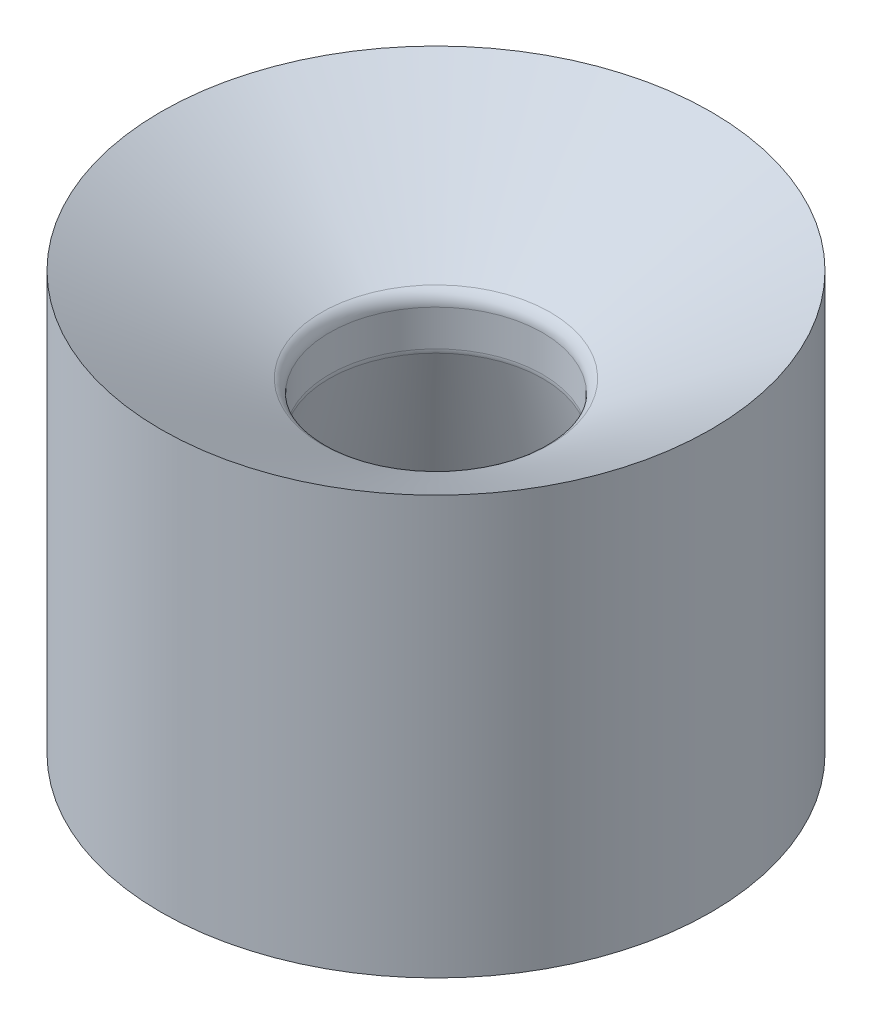
from build123d import *

# Parameters (mm, degrees)
SKETCH1_R            = 44.2849
BOSS_EXTRUDE1_DEPTH  = 86.106
FILLET1_R            = 2.54
MOVE_FACE1_OUTLINE_R = 44.2849
MOVE_FACE1_DEPTH     = 18.796


# Read off the part's stored shape, not the designer's step: Move Face1
with BuildPart() as part:
    # Sketch1 → Boss-Extrude1 (new body)
    with BuildSketch(Plane(origin=(0, 0, 0), x_dir=(1, 0, 0), z_dir=(0, 1, 0))):
        with Locations(Location((0, 0, 0), (0, 0, 270))):
            Circle(SKETCH1_R)
    extrude(amount=BOSS_EXTRUDE1_DEPTH)

    # Sketch2 → Cut-Revolve1 (revolve, cut)
    with BuildSketch(Plane.XY, mode=Mode.PRIVATE) as cut_revolve1_sk:
        Polygon((17.145, 70.358), (17.145, 62.738), (33.955596435, 0), (0, 0), (0, 86.106), (44.2849, 86.106), align=None)
    revolve(cut_revolve1_sk.sketch.rotate(Axis((0, 86.106, 0), (0, -1, 0)), 90), axis=Axis((0, 86.106, 0), (0, -1, 0)), mode=Mode.SUBTRACT)

    # Fillet1
    fillet1_edges = [part.edges().sort_by_distance(p)[0] for p in [
        (0, 70.358, -17.145),
        (0, 62.738, -17.145),
    ]]
    fillet(fillet1_edges, radius=FILLET1_R)

    # Move Face1 outline → Move Face1 (cut)
    with BuildSketch(Plane(origin=(0, 0, 0), x_dir=(1, 0, 0), z_dir=(0, 1, 0))):
        Circle(MOVE_FACE1_OUTLINE_R)
    extrude(amount=MOVE_FACE1_DEPTH, mode=Mode.SUBTRACT)


solid = part.part
